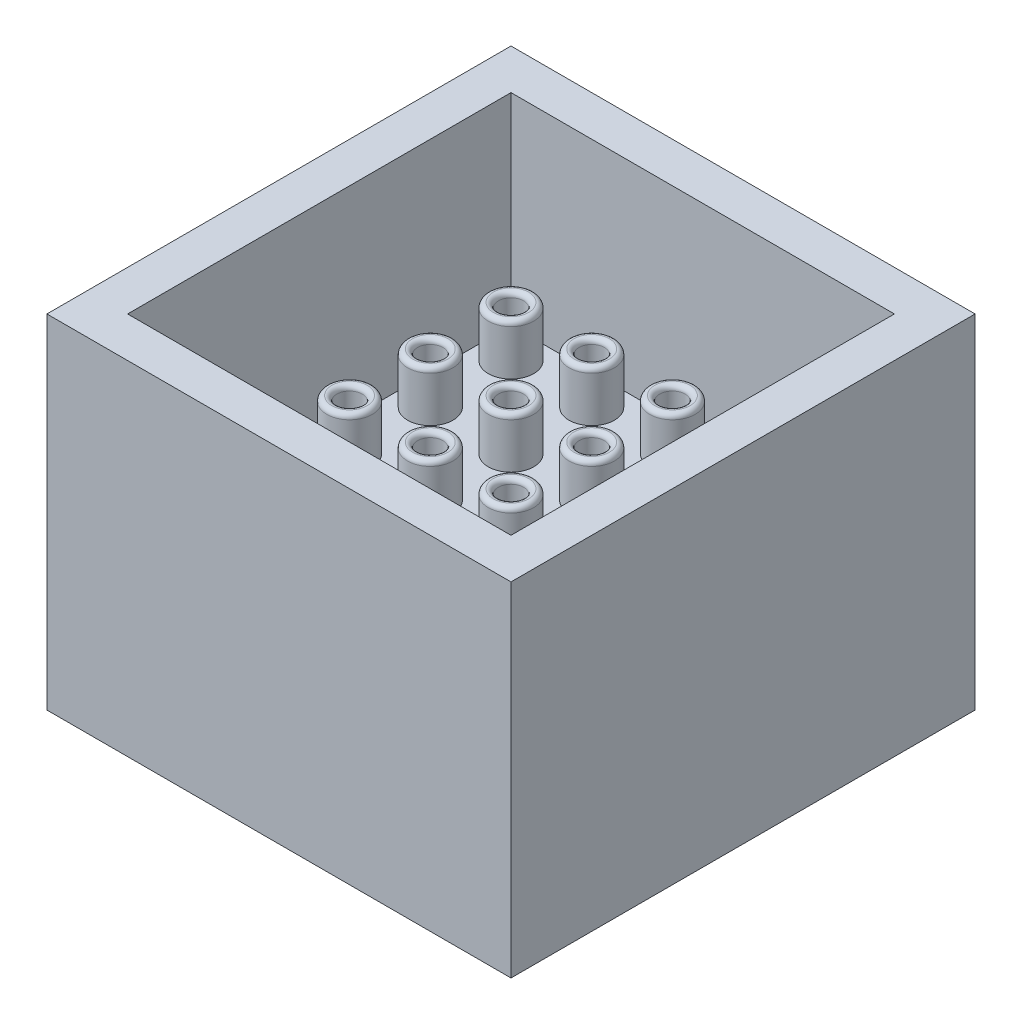
from build123d import *

# Parameters (mm, degrees)
SKETCH1_W              = 23
SKETCH1_H              = 23
SKETCH1_W_2            = 19
SKETCH1_H_2            = 19
BOSS_EXTRUDE1_DEPTH    = 10
SKETCH2_W              = 23
SKETCH2_H              = 23
BOSS_EXTRUDE2_DEPTH    = 2
SKETCH3_W              = 23
SKETCH3_H              = 23
SKETCH3_W_2            = 19
SKETCH3_H_2            = 19
BOSS_EXTRUDE3_DEPTH    = 5
SKETCH6_R              = 1.125
BOSS_EXTRUDE5_DEPTH    = 2.5
CUT_EXTRUDE2_REACH     = 20.835
SKETCH7_R              = 0.625
FILLET3_R              = 0.25
LPATTERN1_COUNT        = 5
LPATTERN1_PITCH        = 4
LPATTERN1_COUNT_DIR2   = 5
LPATTERN1_PITCH_DIR2   = 4
FILLET3_OF_LPATTERN1_R = 0.25


with BuildPart() as part:
    # Sketch1 → Boss-Extrude1 (new body)
    with BuildSketch(Plane(origin=(0, 0, 0), x_dir=(1, 0, 0), z_dir=(0, 1, 0))):
        Rectangle(SKETCH1_W, SKETCH1_H)
        Rectangle(SKETCH1_W_2, SKETCH1_H_2, mode=Mode.SUBTRACT)
    extrude(amount=BOSS_EXTRUDE1_DEPTH)

    # Sketch2 → Boss-Extrude2 (add)
    with BuildSketch(Plane.XZ):
        Rectangle(SKETCH2_W, SKETCH2_H)
    extrude(amount=BOSS_EXTRUDE2_DEPTH)

    # Sketch3 → Boss-Extrude3 (add)
    with BuildSketch(Plane.XZ.offset(2)):
        Rectangle(SKETCH3_W, SKETCH3_H)
        Rectangle(SKETCH3_W_2, SKETCH3_H_2, mode=Mode.SUBTRACT)
    extrude(amount=BOSS_EXTRUDE3_DEPTH)

    # Sketch6 → Boss-Extrude5 (add)
    with BuildSketch(Plane(origin=(0, 0, 0), x_dir=(1, 0, 0), z_dir=(0, 1, 0))):
        with Locations(Location((8, 8, 0), (0, 0, 90))):
            Circle(SKETCH6_R)
    boss_extrude5 = extrude(amount=BOSS_EXTRUDE5_DEPTH)

    # Sketch7 → Cut-Extrude2 (cut, up to next)
    with BuildSketch(Plane(origin=(0, 2.5, 0), x_dir=(1, 0, 0), z_dir=(0, 1, 0)), mode=Mode.PRIVATE) as cut_extrude2_sk1:
        with Locations(Location((8, 8, 0), (0, 0, 270))):
            Circle(SKETCH7_R)
    cut_extrude2_tool1 = extrude(cut_extrude2_sk1.sketch, amount=-CUT_EXTRUDE2_REACH, mode=Mode.PRIVATE) & part.part
    cut_extrude2 = cut_extrude2_tool1.solids().sort_by_distance((8, 2.5, -8))[0]
    add(cut_extrude2, mode=Mode.SUBTRACT)

    # Fillet3
    fillet3_edges = [part.edges().sort_by_distance(p)[0] for p in [
        (8, 2.5, -6.875),
        (8, 2.5, -8.625),
    ]]
    fillet(fillet3_edges, radius=FILLET3_R - 0.0001)  # a hair under: the kernel refuses the full size

    # LPattern1: Boss-Extrude5, Cut-Extrude2 5 × 5
    with Locations(*[(-j * LPATTERN1_PITCH_DIR2, 0, i * LPATTERN1_PITCH) for i in range(LPATTERN1_COUNT) for j in range(LPATTERN1_COUNT_DIR2) if (i, j) != (0, 0)]):
        add(boss_extrude5)
        add(cut_extrude2, mode=Mode.SUBTRACT)

    # Fillet3 of LPattern1
    fillet3_of_lpattern1_edges = [part.edges().sort_by_distance(p)[0] for p in [
        (4, 2.5, -6.875),
        (4, 2.5, -8.625),
        (0, 2.5, -6.875),
        (0, 2.5, -8.625),
        (-4, 2.5, -6.875),
        (-4, 2.5, -8.625),
        (-8, 2.5, -6.875),
        (-8, 2.5, -8.625),
        (8, 2.5, -2.875),
        (8, 2.5, -4.625),
        (4, 2.5, -2.875),
        (4, 2.5, -4.625),
        (0, 2.5, -2.875),
        (0, 2.5, -4.625),
        (-4, 2.5, -2.875),
        (-4, 2.5, -4.625),
        (-8, 2.5, -2.875),
        (-8, 2.5, -4.625),
        (8, 2.5, 1.125),
        (8, 2.5, -0.625),
        (4, 2.5, 1.125),
        (4, 2.5, -0.625),
        (0, 2.5, 1.125),
        (0, 2.5, -0.625),
        (-4, 2.5, 1.125),
        (-4, 2.5, -0.625),
        (-8, 2.5, 1.125),
        (-8, 2.5, -0.625),
        (8, 2.5, 5.125),
        (8, 2.5, 3.375),
        (4, 2.5, 5.125),
        (4, 2.5, 3.375),
        (0, 2.5, 5.125),
        (0, 2.5, 3.375),
        (-4, 2.5, 5.125),
        (-4, 2.5, 3.375),
        (-8, 2.5, 5.125),
        (-8, 2.5, 3.375),
        (8, 2.5, 9.125),
        (8, 2.5, 7.375),
        (4, 2.5, 9.125),
        (4, 2.5, 7.375),
        (0, 2.5, 9.125),
        (0, 2.5, 7.375),
        (-4, 2.5, 9.125),
        (-4, 2.5, 7.375),
        (-8, 2.5, 9.125),
        (-8, 2.5, 7.375),
    ]]
    fillet(fillet3_of_lpattern1_edges, radius=FILLET3_OF_LPATTERN1_R - 0.0001)  # a hair under: the kernel refuses the full size


solid = part.part
